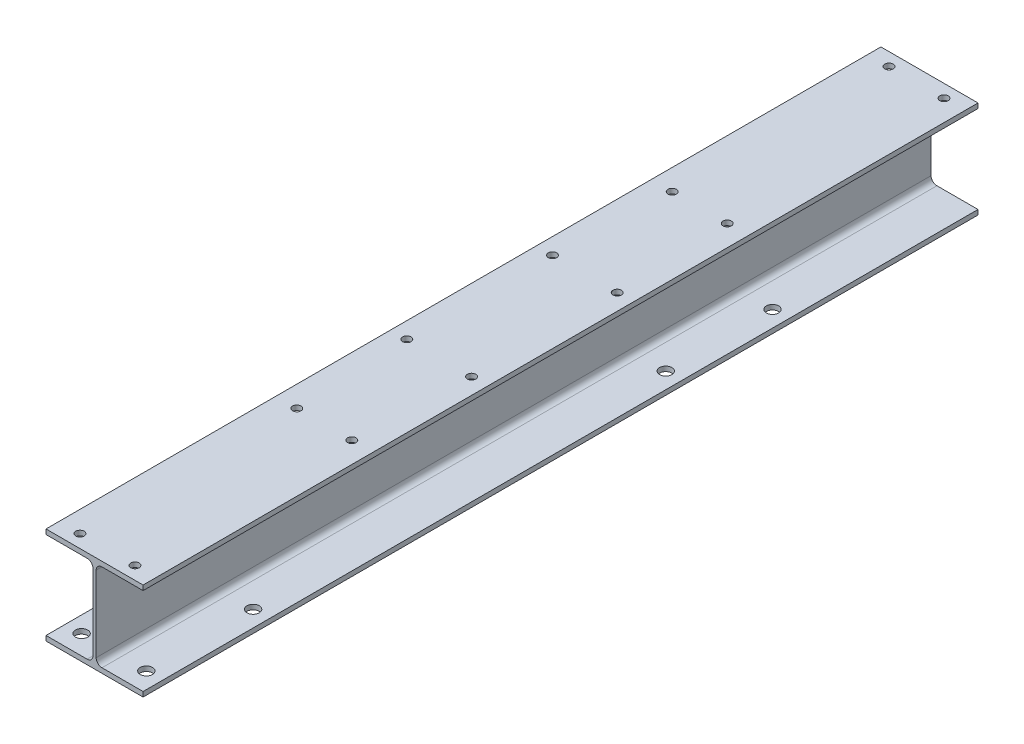
from build123d import *

# Parameters (mm, degrees)
EXTRUDE_1_DEPTH     = 1290
SKETCH_2_R          = 19
CUT_EXTRUDE_1_DEPTH = 60
SKETCH_3_R          = 13
CUT_EXTRUDE_2_DEPTH = 60


with BuildPart() as part:
    # Эскиз1 → Бобышка-Вытянуть1 (new, symmetric)
    with BuildSketch(Plane.XY):
        with BuildLine():
            Line((150, 300), (-150, 300))
            Line((-150, 300), (-150, 285))
            Line((-150, 285), (-23, 285))
            ThreePointArc((-23, 285), (-10.272077939, 279.727922061), (-5, 267))
            Line((-5, 267), (-5, 33))
            ThreePointArc((-5, 33), (-10.272077939, 20.272077939), (-23, 15))
            Line((-23, 15), (-150, 15))
            Line((-150, 15), (-150, 0))
            Line((-150, 0), (150, 0))
            Line((150, 0), (150, 15))
            Line((150, 15), (23, 15))
            ThreePointArc((23, 15), (10.272077939, 20.272077939), (5, 33))
            Line((5, 33), (5, 267))
            ThreePointArc((5, 267), (10.272077939, 279.727922061), (23, 285))
            Line((23, 285), (150, 285))
            Line((150, 285), (150, 300))
        make_face()
    extrude(amount=EXTRUDE_1_DEPTH, both=True)

    # Эскиз2 → Вырез-Вытянуть1 (cut)
    with BuildSketch(Plane.XZ):
        with Locations((-100, 1230)):
            Circle(SKETCH_2_R)
        with Locations((100, 1230)):
            Circle(SKETCH_2_R)
        with Locations((-100, 900)):
            Circle(SKETCH_2_R)
        with Locations((100, 900)):
            Circle(SKETCH_2_R)
        with Locations((-100, -705)):
            Circle(SKETCH_2_R)
        with Locations((100, -705)):
            Circle(SKETCH_2_R)
        with Locations((-100, -375)):
            Circle(SKETCH_2_R)
        with Locations((100, -375)):
            Circle(SKETCH_2_R)
    extrude(amount=-CUT_EXTRUDE_1_DEPTH, mode=Mode.SUBTRACT)

    # Эскиз3 → Вырез-Вытянуть2 (cut)
    with BuildSketch(Plane(origin=(0, 300, 0), x_dir=(1, 0, 0), z_dir=(0, 1, 0))):
        with Locations((-85, -1250)):
            Circle(SKETCH_3_R)
        with Locations((85, -1250)):
            Circle(SKETCH_3_R)
        with Locations((-85, -580)):
            Circle(SKETCH_3_R)
        with Locations((85, -580)):
            Circle(SKETCH_3_R)
        with Locations((-100, -225)):
            Circle(SKETCH_3_R)
        with Locations((100, -225)):
            Circle(SKETCH_3_R)
        with Locations((-100, 225)):
            Circle(SKETCH_3_R)
        with Locations((100, 225)):
            Circle(SKETCH_3_R)
        with Locations((-85, 580)):
            Circle(SKETCH_3_R)
        with Locations((85, 580)):
            Circle(SKETCH_3_R)
        with Locations((-85, 1250)):
            Circle(SKETCH_3_R)
        with Locations((85, 1250)):
            Circle(SKETCH_3_R)
    extrude(amount=-CUT_EXTRUDE_2_DEPTH, mode=Mode.SUBTRACT)


solid = part.part
